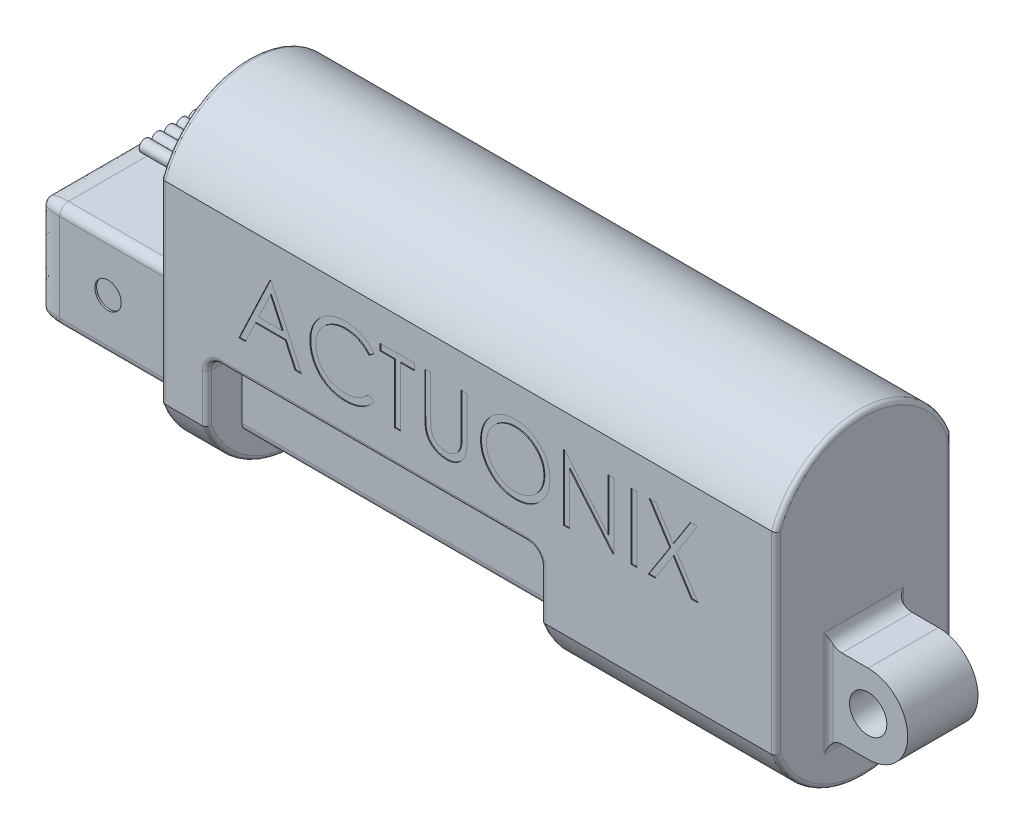
from build123d import *

# Parameters (mm, degrees)
SKETCH1_R               = 2.125
BOSS_EXTRUDE1_DEPTH     = 10
SKETCH2_W               = 9
SKETCH2_H               = 6
CUT_EXTRUDE1_DEPTH      = 58.723478759
SKETCH3_W               = 38
SKETCH3_H               = 4.5
CUT_EXTRUDE2_DEPTH      = 52.575187833
SKETCH4_W               = 38
SKETCH4_H               = 4
CUT_EXTRUDE3_DEPTH      = 9.5
CUT_EXTRUDE4_DEPTH      = 73.965745388
CUT_EXTRUDE4_DEPTH_BACK = 73.965745388
CUT_EXTRUDE5_DEPTH      = 73.965745388
BOSS_EXTRUDE2_DEPTH     = 4.31
SKETCH8_R               = 0.675
BOSS_EXTRUDE3_DEPTH     = 7.5
BOSS_EXTRUDE3_2_DEPTH   = 7.5
BOSS_EXTRUDE3_3_DEPTH   = 7.5
BOSS_EXTRUDE3_4_DEPTH   = 7.5
BOSS_EXTRUDE3_5_DEPTH   = 7.5
BOSS_EXTRUDE4_DEPTH     = 17.5
SKETCH10_R              = 4.5
CUT_EXTRUDE6_DEPTH      = 50
SKETCH12_W              = 0.673076923
SKETCH12_H              = 7.5
CUT_EXTRUDE7_DEPTH      = 0.1
SKETCH13_W              = 0.673076923
SKETCH13_H              = 7.5
CUT_EXTRUDE8_DEPTH      = 0.1
FILLET1_SIZE            = 2
FILLET1_SIZE_2          = 0.5
SKETCH14_R              = 1.5
CUT_EXTRUDE9_DEPTH      = 0.2
SKETCH15_R              = 1.5
CUT_EXTRUDE10_DEPTH     = 0.2
FILLET2_R               = 1.5
FILLET3_R               = 1.5
FILLET4_R               = 0.5
FILLET5_R               = 1
FILLET6_R               = 0.5


with BuildPart() as part:
    # Sketch1 → Boss-Extrude1 (new, symmetric)
    with BuildSketch(Plane.XY):
        with BuildLine():
            Line((39.5, -12), (35, -12))
            Line((35, -12), (35, -18))
            Line((35, -18), (-35, -18))
            Line((-35, -18), (-35, 18))
            Line((-35, 18), (35, 18))
            Line((35, 18), (35, -3))
            Line((35, -3), (39.5, -3))
            ThreePointArc((39.5, -3), (44, -7.5), (39.5, -12))
        make_face()
        with Locations((39.5, -7.5)):
            Circle(SKETCH1_R, mode=Mode.SUBTRACT)
    extrude(amount=BOSS_EXTRUDE1_DEPTH, both=True)

    # Sketch2 → Cut-Extrude1 (cut, through all)
    with BuildSketch(Plane(origin=(0, 18, 0), x_dir=(1, 0, 0), z_dir=(0, 1, 0))):
        with Locations((39.5, -7)):
            Rectangle(SKETCH2_W, SKETCH2_H)
        with Locations((39.5, 7)):
            Rectangle(SKETCH2_W, SKETCH2_H)
    extrude(amount=-CUT_EXTRUDE1_DEPTH, mode=Mode.SUBTRACT)

    # Sketch3 → Cut-Extrude2 (cut, through all)
    with BuildSketch(Plane.XY.offset(10)):
        with Locations((-10.75, -15.75)):
            Rectangle(SKETCH3_W, SKETCH3_H)
    extrude(amount=-CUT_EXTRUDE2_DEPTH, mode=Mode.SUBTRACT)

    # Sketch4 → Cut-Extrude3 (cut)
    with BuildSketch(Plane.XZ.offset(13.5)):
        with Locations((-10.75, -8)):
            Rectangle(SKETCH4_W, SKETCH4_H)
        with Locations((-10.75, 8)):
            Rectangle(SKETCH4_W, SKETCH4_H)
    extrude(amount=-CUT_EXTRUDE3_DEPTH, mode=Mode.SUBTRACT)

    # Sketch6 → Cut-Extrude4 (cut, two sides: drawn at the far end of the back side and taken through both)
    with BuildSketch(Plane(origin=(35, 0, 0), x_dir=(0, 0, -1), z_dir=(1, 0, 0)).offset(-CUT_EXTRUDE4_DEPTH_BACK)):
        with BuildLine():
            Line((-10, 18), (-10, 11))
            ThreePointArc((-10, 11), (-6.103277819, 16.076111146), (-2.8e-08, 18))
            Line((-2.8e-08, 18), (-10, 18))
        make_face()
        with BuildLine():
            Line((10, 18), (-2.8e-08, 18))
            ThreePointArc((-2.8e-08, 18), (6.103277797, 16.076111162), (10, 11))
            Line((10, 11), (10, 18))
        make_face()
    extrude(amount=CUT_EXTRUDE4_DEPTH + CUT_EXTRUDE4_DEPTH_BACK, mode=Mode.SUBTRACT)

    # Sketch7 → Cut-Extrude5 (cut, through all)
    with BuildSketch(Plane(origin=(35, 0, 0), x_dir=(0, 0, -1), z_dir=(1, 0, 0))):
        with BuildLine():
            ThreePointArc((-4.6e-08, -18), (-6.103277827, -16.076111141), (-10, -11))
            Line((-10, -11), (-10, -18))
            Line((-10, -18), (-4.6e-08, -18))
        make_face()
        with BuildLine():
            ThreePointArc((10, -11), (6.103277789, -16.076111167), (-4.6e-08, -18))
            Line((-4.6e-08, -18), (10, -18))
            Line((10, -18), (10, -11))
        make_face()
    extrude(amount=-CUT_EXTRUDE5_DEPTH, mode=Mode.SUBTRACT)


with BuildPart() as body_2:
    # Sketch5 → Boss-Extrude2 (new body)
    with BuildSketch(Plane.ZY.offset(35)):
        with BuildLine():
            Line((-5.625, 5.25), (1.125, 5.25))
            ThreePointArc((1.125, 5.25), (3, 3.375), (1.125, 1.5))
            Line((1.125, 1.5), (-5.625, 1.5))
            ThreePointArc((-5.625, 1.5), (-7.5, 3.375), (-5.625, 5.25))
        make_face()
    extrude(amount=BOSS_EXTRUDE2_DEPTH)


with BuildPart() as body_3:
    # Sketch8 → Boss-Extrude3 (new body)
    with BuildSketch(Plane.ZY.offset(39.31)):
        with Locations((-5.625, 3.375)):
            Circle(SKETCH8_R)
    extrude(amount=BOSS_EXTRUDE3_DEPTH)


with BuildPart() as body_4:
    # Sketch8 → Boss-Extrude3 2 (new body)
    with BuildSketch(Plane.ZY.offset(39.31)):
        with Locations((-4.225, 3.375)):
            Circle(SKETCH8_R)
    extrude(amount=BOSS_EXTRUDE3_2_DEPTH)


with BuildPart() as body_5:
    # Sketch8 → Boss-Extrude3 3 (new body)
    with BuildSketch(Plane.ZY.offset(39.31)):
        with Locations((-2.825, 3.375)):
            Circle(SKETCH8_R)
    extrude(amount=BOSS_EXTRUDE3_3_DEPTH)


with BuildPart() as body_6:
    # Sketch8 → Boss-Extrude3 4 (new body)
    with BuildSketch(Plane.ZY.offset(39.31)):
        with Locations((-1.425, 3.375)):
            Circle(SKETCH8_R)
    extrude(amount=BOSS_EXTRUDE3_4_DEPTH)


with BuildPart() as body_7:
    # Sketch8 → Boss-Extrude3 5 (new body)
    with BuildSketch(Plane.ZY.offset(39.31)):
        with Locations((-0.025, 3.375)):
            Circle(SKETCH8_R)
    extrude(amount=BOSS_EXTRUDE3_5_DEPTH)


with BuildPart() as body_8:
    # Sketch9 → Boss-Extrude4 (new body)
    with BuildSketch(Plane.ZY.offset(35)):
        with BuildLine():
            Line((-6, -4), (-6, -2.5))
            ThreePointArc((-6, -2.5), (-5.707106781, -1.792893219), (-5, -1.5))
            Line((-5, -1.5), (5, -1.5))
            ThreePointArc((5, -1.5), (5.707106781, -1.792893219), (6, -2.5))
            Line((6, -2.5), (6, -4))
            Line((6, -4), (6, -12.5))
            ThreePointArc((6, -12.5), (5.707106781, -13.207106781), (5, -13.5))
            Line((5, -13.5), (-5, -13.5))
            ThreePointArc((-5, -13.5), (-5.707106781, -13.207106781), (-6, -12.5))
            Line((-6, -12.5), (-6, -4))
        make_face()
    extrude(amount=BOSS_EXTRUDE4_DEPTH)


with BuildPart() as cut_extrude6_tool:
    # Sketch10 → Cut-Extrude6 (new body)
    with BuildSketch(Plane.ZY.offset(52.5)):
        with Locations((0, -7.5)):
            Circle(SKETCH10_R)
    extrude(amount=-CUT_EXTRUDE6_DEPTH)


with BuildPart() as part_1:
    add(part.part)

    # Cut-Extrude6: cut by cut_extrude6_tool
    add(cut_extrude6_tool.part, mode=Mode.SUBTRACT)

    # Sketch12 → Cut-Extrude7 (cut)
    # profile 1 of 8: a face of its own
    with BuildSketch(Plane.XY.offset(10)):
        Polygon((-22.451923077, 7.25), (-18.990384615, -0.25), (-19.722055288, -0.25), (-20.830829327, 2.153846154), (-24.230769231, 2.153846154), (-25.37109375, -0.25), (-26.105769231, -0.25), (-22.548076923, 7.25), align=None)
        Polygon((-22.507512019, 5.788161058), (-23.865685096, 2.923076923), (-21.185396635, 2.923076923), align=None, mode=Mode.SUBTRACT)
    # profile 2 of 8: a face of its own
    with BuildSketch(Plane.XY.offset(10)):
        with BuildLine():
            Line((-10.721153846, 5.873798077), (-11.310096154, 5.423076923))
            add(Edge.make_bspline(
                [(-11.310096154, 5.423076923), (-11.352108772, 5.473146858), (-11.435567586, 5.572611678), (-11.569837306, 5.71228213), (-11.709769398, 5.843136262), (-11.855310372, 5.965797433), (-12.009079914, 6.075976216), (-12.167353054, 6.179414294), (-12.332777436, 6.272130875), (-12.561531153, 6.38455156), (-12.860776543, 6.501864749), (-13.237479769, 6.600228816), (-13.630717837, 6.662845621), (-13.898998408, 6.669627424), (-14.035456731, 6.673076923)],
                knots=[0, 0, 0, 0, 0.757959112, 1.505699292, 2.245454638, 2.979532153, 3.711538275, 4.438200793, 5.171680507, 5.909471876, 7.393775596, 8.890124382, 10.418191784, 12, 12, 12, 12], degree=3))
            add(Edge.make_bspline(
                [(-14.035456731, 6.673076923), (-14.110635229, 6.672211289), (-14.260294499, 6.670488055), (-14.482398371, 6.647754215), (-14.700354909, 6.615801622), (-14.914022337, 6.568390216), (-15.123128676, 6.508448889), (-15.329040967, 6.436823002), (-15.528777966, 6.348205488), (-15.725102762, 6.250259217), (-15.913201072, 6.139628978), (-16.091176174, 6.01895751), (-16.258378962, 5.88959516), (-16.414941703, 5.751057075), (-16.561024449, 5.60396716), (-16.695568687, 5.446757856), (-16.818108851, 5.27993177), (-16.931073905, 5.105688754), (-17.032244048, 4.924536343), (-17.116950932, 4.73580405), (-17.191961909, 4.542723829), (-17.251317428, 4.343114198), (-17.298298536, 4.1383797), (-17.330714957, 3.927970869), (-17.353190253, 3.71232727), (-17.354904917, 3.566164457), (-17.355769231, 3.492487981)],
                knots=[0, 0, 0, 0, 1.054917814, 2.100044995, 3.131103042, 4.146048494, 5.169673617, 6.183595914, 7.203665975, 8.234915748, 9.262203917, 10.264457458, 11.251630812, 12.227803204, 13.197192746, 14.159520551, 15.12972552, 16.100847026, 17.073214652, 18.039054194, 19.002613845, 19.979014051, 20.95965708, 21.949030935, 22.966165397, 24, 24, 24, 24], degree=3))
            add(Edge.make_bspline(
                [(-17.355769231, 3.492487981), (-17.353065333, 3.381635152), (-17.347756588, 3.163990328), (-17.300510158, 2.845196162), (-17.228713534, 2.539794718), (-17.121108726, 2.249695056), (-16.988425046, 1.971320003), (-16.820766593, 1.709379603), (-16.626588299, 1.459915536), (-16.403143114, 1.228823505), (-16.157987794, 1.017722666), (-15.894956555, 0.831828562), (-15.61470451, 0.6768681), (-15.320326016, 0.547919643), (-15.009555772, 0.448798084), (-14.682952624, 0.379017819), (-14.34122692, 0.333498861), (-14.107721063, 0.329140958), (-13.988882212, 0.326923077)],
                knots=[0, 0, 0, 0, 1.029171465, 2.020641659, 2.987623507, 3.938342917, 4.889210282, 5.84687017, 6.821220943, 7.821438502, 8.827599549, 9.822697543, 10.807740252, 11.797342354, 12.80366471, 13.83203677, 14.896651826, 16, 16, 16, 16], degree=3))
            add(Edge.make_bspline(
                [(-13.988882212, 0.326923077), (-13.857947878, 0.330541891), (-13.600237787, 0.337664582), (-13.222306302, 0.39800583), (-12.860515376, 0.495844225), (-12.514845548, 0.632768345), (-12.186271306, 0.81076539), (-11.874278462, 1.026546556), (-11.578603668, 1.282164412), (-11.400808064, 1.477342544), (-11.310096154, 1.576923077)],
                knots=[0, 0, 0, 0, 1.028121516, 2.023589091, 2.998037872, 3.967518031, 4.937445131, 5.927275754, 6.942489185, 8, 8, 8, 8], degree=3))
            Line((-11.310096154, 1.576923077), (-10.721153846, 1.130709135))
            add(Edge.make_bspline(
                [(-10.721153846, 1.130709135), (-10.768549796, 1.069555309), (-10.863114671, 0.947540581), (-11.016238994, 0.775529775), (-11.177547488, 0.613735413), (-11.348238295, 0.463461939), (-11.526347849, 0.32170237), (-11.715074232, 0.19248416), (-11.911936445, 0.074003694), (-12.116267471, -0.034482573), (-12.327850213, -0.130733817), (-12.546431145, -0.213134748), (-12.771068092, -0.284116654), (-13.001771324, -0.342513661), (-13.239019375, -0.388094555), (-13.481956105, -0.418565287), (-13.731105838, -0.439440818), (-13.899194597, -0.441343495), (-13.984375, -0.442307692)],
                knots=[0, 0, 0, 0, 0.986787822, 1.968848986, 2.935600012, 3.899624008, 4.868462664, 5.837806735, 6.815139263, 7.798259679, 8.787526145, 9.778297419, 10.776456485, 11.791383307, 12.812564526, 13.85620153, 14.913611965, 16, 16, 16, 16], degree=3))
            add(Edge.make_bspline(
                [(-13.984375, -0.442307692), (-14.065040001, -0.44174628), (-14.224545051, -0.440636156), (-14.460042376, -0.42265294), (-14.689305763, -0.398117789), (-14.911679962, -0.361174651), (-15.12837848, -0.317579637), (-15.337436875, -0.25914123), (-15.540912326, -0.19367873), (-15.737987341, -0.116739473), (-15.928829555, -0.029919082), (-16.112823437, 0.068205687), (-16.289884363, 0.176809683), (-16.461753122, 0.293498991), (-16.625890802, 0.422021781), (-16.783719785, 0.560593141), (-16.936125091, 0.708746021), (-17.030416559, 0.815577849), (-17.077824519, 0.869290865)],
                knots=[0, 0, 0, 0, 1.114604814, 2.203992996, 3.262667896, 4.300477797, 5.318619304, 6.316056647, 7.298880507, 8.271930387, 9.238335007, 10.195173496, 11.151986948, 12.108099108, 13.064862484, 14.031167946, 15.010108607, 16, 16, 16, 16], degree=3))
            add(Edge.make_bspline(
                [(-17.077824519, 0.869290865), (-17.153758041, 0.962593413), (-17.304708349, 1.148072078), (-17.497834813, 1.448684895), (-17.663151003, 1.762545343), (-17.79681369, 2.091302333), (-17.901305261, 2.434218163), (-17.973693537, 2.791465694), (-18.020732689, 3.162711284), (-18.026111879, 3.415218688), (-18.028846154, 3.543569712)],
                knots=[0, 0, 0, 0, 0.994628077, 1.977248131, 2.950237994, 3.925870899, 4.908910175, 5.911660606, 6.938484602, 8, 8, 8, 8], degree=3))
            add(Edge.make_bspline(
                [(-18.028846154, 3.543569712), (-18.025513596, 3.678474255), (-18.018956997, 3.943890522), (-17.963251721, 4.333406136), (-17.873640015, 4.706587705), (-17.746360968, 5.062738586), (-17.584992358, 5.403732044), (-17.385649614, 5.726963197), (-17.150648595, 6.034499196), (-16.881832379, 6.321673663), (-16.587045232, 6.58425799), (-16.271362059, 6.815271284), (-15.935400744, 7.007523104), (-15.58286249, 7.168229167), (-15.211107458, 7.291753016), (-14.82092881, 7.37822413), (-14.413059707, 7.432046522), (-14.134783081, 7.438850539), (-13.993389423, 7.442307692)],
                knots=[0, 0, 0, 0, 1.032925535, 2.032216505, 3.007276963, 3.968222605, 4.92396291, 5.891752235, 6.871517503, 7.883894988, 8.900124299, 9.891468569, 10.874487609, 11.85992873, 12.854644235, 13.869047385, 14.917252991, 16, 16, 16, 16], degree=3))
            add(Edge.make_bspline(
                [(-13.993389423, 7.442307692), (-13.907215555, 7.441274539), (-13.73664306, 7.439229516), (-13.484315948, 7.419287783), (-13.238653819, 7.386044341), (-12.999487429, 7.34079562), (-12.765653251, 7.284637074), (-12.538938449, 7.211479292), (-12.318012692, 7.127829582), (-12.104269317, 7.031490012), (-11.898733853, 6.923346995), (-11.701470313, 6.80459923), (-11.514045616, 6.675393933), (-11.33514094, 6.536829985), (-11.16774906, 6.38597593), (-11.00711732, 6.226981081), (-10.858700724, 6.055265744), (-10.767086735, 5.934398028), (-10.721153846, 5.873798077)],
                knots=[0, 0, 0, 0, 1.096760587, 2.17092713, 3.219439832, 4.250915756, 5.268269357, 6.278326846, 7.281116186, 8.274029601, 9.260640565, 10.235837813, 11.203064059, 12.156899882, 13.114053108, 14.069676657, 15.032185724, 16, 16, 16, 16], degree=3))
        make_face()
    # profile 3 of 8: a face of its own
    with BuildSketch(Plane.XY.offset(10)):
        Polygon((-10.048076923, 6.480769231), (-10.048076923, 7.25), (-6.105769231, 7.25), (-6.105769231, 6.480769231), (-7.740384615, 6.480769231), (-7.740384615, -0.25), (-8.413461538, -0.25), (-8.413461538, 6.480769231), align=None)
    # profile 4 of 8: a face of its own
    with BuildSketch(Plane.XY.offset(10)):
        with BuildLine():
            Line((-4.951923077, 7.25), (-4.278846154, 7.25))
            Line((-4.278846154, 7.25), (-4.278846154, 2.756310096))
            add(Edge.make_bspline(
                [(-4.278846154, 2.756310096), (-4.27894632, 2.69270852), (-4.279136401, 2.572013568), (-4.277866729, 2.400224352), (-4.274310939, 2.247497654), (-4.272069169, 2.113244766), (-4.267082025, 1.998081736), (-4.263014782, 1.901384642), (-4.257785018, 1.823611351), (-4.251499766, 1.778223652), (-4.248798077, 1.758713942)],
                knots=[0, 0, 0, 0, 1.528628734, 2.90083645, 4.128790002, 5.200304208, 6.127813768, 6.898992206, 7.526736466, 8, 8, 8, 8], degree=3))
            add(Edge.make_bspline(
                [(-4.248798077, 1.758713942), (-4.237703522, 1.688328021), (-4.216139552, 1.551522173), (-4.161183028, 1.356718712), (-4.08443124, 1.181151301), (-3.993481863, 1.019341391), (-3.873626267, 0.875792763), (-3.730047263, 0.743553507), (-3.556094902, 0.62789964), (-3.362679318, 0.5221479), (-3.154210952, 0.437151295), (-2.94118681, 0.3728798), (-2.726808997, 0.333710729), (-2.583288644, 0.329175288), (-2.512019231, 0.326923077)],
                knots=[0, 0, 0, 0, 1.035780045, 2.013197591, 2.933192213, 3.817615948, 4.702609284, 5.640816605, 6.646850145, 7.73207398, 8.84249596, 9.914020372, 10.964143139, 12, 12, 12, 12], degree=3))
            add(Edge.make_bspline(
                [(-2.512019231, 0.326923077), (-2.450832644, 0.329224185), (-2.328812869, 0.33381311), (-2.147513374, 0.362230462), (-1.970941713, 0.41344596), (-1.79822597, 0.479531156), (-1.636331004, 0.566847423), (-1.485166485, 0.667713507), (-1.350243769, 0.786022528), (-1.227119488, 0.916951837), (-1.119901768, 1.06467998), (-1.026963608, 1.225990276), (-0.950836615, 1.403310305), (-0.913243348, 1.527926924), (-0.893930288, 1.591947115)],
                knots=[0, 0, 0, 0, 0.994687771, 1.983630487, 2.973142513, 3.978332533, 4.983357753, 5.956394766, 6.925816176, 7.893390482, 8.871859704, 9.88551698, 10.913711441, 12, 12, 12, 12], degree=3))
            add(Edge.make_bspline(
                [(-0.893930288, 1.591947115), (-0.887501449, 1.618408346), (-0.873175402, 1.677374632), (-0.859788877, 1.777063112), (-0.845846323, 1.894683177), (-0.836172244, 2.031079919), (-0.826741058, 2.185796289), (-0.821098759, 2.359638269), (-0.818490831, 2.551974614), (-0.817713659, 2.686197103), (-0.817307692, 2.756310096)],
                knots=[0, 0, 0, 0, 0.558680831, 1.244966039, 2.062412453, 2.990489873, 4.051219941, 5.244515665, 6.560634259, 8, 8, 8, 8], degree=3))
            Line((-0.817307692, 2.756310096), (-0.817307692, 7.25))
            Line((-0.817307692, 7.25), (-0.144230769, 7.25))
            Line((-0.144230769, 7.25), (-0.144230769, 2.720252404))
            add(Edge.make_bspline(
                [(-0.144230769, 2.720252404), (-0.144775313, 2.63861302), (-0.145838023, 2.4792888), (-0.155053544, 2.245821602), (-0.169747115, 2.024350928), (-0.190507304, 1.814847007), (-0.218015168, 1.618059523), (-0.248604926, 1.432263591), (-0.287561068, 1.258792892), (-0.333061214, 1.096294854), (-0.385075959, 0.941611611), (-0.452449849, 0.794807437), (-0.528359491, 0.651419438), (-0.61839089, 0.513616347), (-0.719558139, 0.380788019), (-0.834097455, 0.253740001), (-0.958220657, 0.130442045), (-1.093991142, 0.014056903), (-1.239170839, -0.092675976), (-1.393327891, -0.186528342), (-1.555278112, -0.265864666), (-1.724600525, -0.331170218), (-1.901367388, -0.38027293), (-2.085583159, -0.41686255), (-2.277667145, -0.437653187), (-2.408305694, -0.440743038), (-2.474459135, -0.442307692)],
                knots=[0, 0, 0, 0, 1.316592851, 2.569410997, 3.76748051, 4.895814652, 5.963796859, 6.97159953, 7.931736103, 8.829262218, 9.692595152, 10.560224239, 11.431080259, 12.30701507, 13.211635791, 14.121146779, 15.063487852, 16.031507147, 17.00238618, 17.966455255, 18.938106653, 19.907068911, 20.888905087, 21.893141452, 22.933117798, 24, 24, 24, 24], degree=3))
            add(Edge.make_bspline(
                [(-2.474459135, -0.442307692), (-2.546607212, -0.440626052), (-2.688161481, -0.437326681), (-2.896743053, -0.418420788), (-3.096702045, -0.382809943), (-3.290150353, -0.337467206), (-3.474454276, -0.274930627), (-3.652083085, -0.201863216), (-3.819994545, -0.11212623), (-3.980912677, -0.012283245), (-4.130537155, 0.100055266), (-4.267888733, 0.222498495), (-4.39319417, 0.353085018), (-4.504341376, 0.493228659), (-4.603171843, 0.64183946), (-4.688308015, 0.799337831), (-4.761407824, 0.965662794), (-4.799136182, 1.081276795), (-4.818209135, 1.139723558)],
                knots=[0, 0, 0, 0, 1.13879206, 2.234305948, 3.301075583, 4.341971843, 5.366689343, 6.369221514, 7.369726634, 8.367512178, 9.355451585, 10.318319045, 11.268648973, 12.207971039, 13.137398894, 14.081662264, 15.030215811, 16, 16, 16, 16], degree=3))
            add(Edge.make_bspline(
                [(-4.818209135, 1.139723558), (-4.829303045, 1.179650503), (-4.853365984, 1.266252936), (-4.879134479, 1.409581126), (-4.900796796, 1.574613093), (-4.92116585, 1.761360132), (-4.933185045, 1.969966989), (-4.943722414, 2.200343237), (-4.951997311, 2.452767441), (-4.951948513, 2.628598546), (-4.951923077, 2.720252404)],
                knots=[0, 0, 0, 0, 0.625038921, 1.35572334, 2.194682327, 3.136881307, 4.189498639, 5.346923369, 6.617055217, 8, 8, 8, 8], degree=3))
            Line((-4.951923077, 2.720252404), (-4.951923077, 7.25))
        make_face()
    # profile 5 of 8: a face of its own
    with BuildSketch(Plane.XY.offset(10)):
        with BuildLine():
            add(Edge.make_bspline(
                [(5.288461538, 7.442307692), (5.427336051, 7.438790237), (5.700097052, 7.431881663), (6.100971833, 7.37899787), (6.483675608, 7.287507748), (6.851325906, 7.1656585), (7.199525141, 7.003113389), (7.530894196, 6.806645214), (7.84464464, 6.574195659), (8.136547601, 6.307561602), (8.403669637, 6.0174542), (8.639010822, 5.707858679), (8.836244309, 5.38064696), (8.998213852, 5.036802323), (9.125282302, 4.677102391), (9.212965967, 4.299629528), (9.268976289, 3.906829478), (9.275524383, 3.638914768), (9.278846154, 3.503004808)],
                knots=[0, 0, 0, 0, 1.065120563, 2.091984664, 3.0946048, 4.079830382, 5.057816894, 6.036188127, 7.030412546, 8.04752943, 9.064399622, 10.05169764, 11.02544977, 11.989514704, 12.962713494, 13.945757189, 14.957906945, 16, 16, 16, 16], degree=3))
            add(Edge.make_bspline(
                [(9.278846154, 3.503004808), (9.27552487, 3.368095994), (9.268978234, 3.102175093), (9.212902283, 2.711867713), (9.124957283, 2.336673363), (8.999393855, 1.977218393), (8.838196401, 1.633123613), (8.639649606, 1.305294427), (8.405775583, 0.993623359), (8.139618045, 0.70152479), (7.849472955, 0.433673067), (7.53826524, 0.200275477), (7.21299384, -0.000561933), (6.869473037, -0.160812663), (6.512258673, -0.28889535), (6.138153695, -0.376222414), (5.748911079, -0.432551793), (5.483473214, -0.439020041), (5.348557692, -0.442307692)],
                knots=[0, 0, 0, 0, 1.043624062, 2.057103931, 3.04512605, 4.022047818, 4.998200453, 5.980619268, 6.982898556, 8.009068085, 9.034988726, 10.034168286, 11.015286542, 11.987931943, 12.962482838, 13.94673481, 14.956375938, 16, 16, 16, 16], degree=3))
            add(Edge.make_bspline(
                [(5.348557692, -0.442307692), (5.212648437, -0.438987578), (4.944735117, -0.432442748), (4.55144147, -0.376339737), (4.173703448, -0.288608372), (3.812601267, -0.163231009), (3.46793356, -0.001194086), (3.13902624, 0.196386726), (2.827199496, 0.4308306), (2.535038611, 0.696901832), (2.2677189, 0.986555157), (2.034663095, 1.296914275), (1.837037853, 1.621890254), (1.675544997, 1.962384948), (1.547692584, 2.316752326), (1.460467974, 2.687356206), (1.404033791, 3.072083718), (1.397530549, 3.334032786), (1.394230769, 3.466947115)],
                knots=[0, 0, 0, 0, 1.053102029, 2.075944431, 3.073151272, 4.055350789, 5.033113405, 6.020478099, 7.024410459, 8.052272461, 9.079885166, 10.07527673, 11.055994387, 12.023226415, 12.992069828, 13.970394897, 14.97016774, 16, 16, 16, 16], degree=3))
            add(Edge.make_bspline(
                [(1.394230769, 3.466947115), (1.395376417, 3.556159978), (1.397653259, 3.733460242), (1.425064028, 3.996745814), (1.464839102, 4.255797224), (1.521843201, 4.509877827), (1.596396773, 4.758365651), (1.684365403, 5.002974428), (1.791807929, 5.241225265), (1.91326646, 5.474246819), (2.048827478, 5.698406617), (2.198561226, 5.910291438), (2.357208444, 6.111679288), (2.531130002, 6.297351439), (2.714593813, 6.472709274), (2.910576052, 6.635057954), (3.117880862, 6.78586142), (3.337400247, 6.921762151), (3.563725122, 7.044674582), (3.797032503, 7.150149977), (4.034153727, 7.240677252), (4.276199401, 7.314050449), (4.52252677, 7.37197624), (4.773673451, 7.411420569), (5.029439365, 7.438901251), (5.201749334, 7.441167326), (5.288461538, 7.442307692)],
                knots=[0, 0, 0, 0, 1.037015668, 2.060948919, 3.074880161, 4.083647147, 5.086022904, 6.090072063, 7.104153813, 8.122640571, 9.144368836, 10.147691507, 11.138137339, 12.123020368, 13.103399296, 14.087645067, 15.080126199, 16.082011238, 17.087798457, 18.072939717, 19.057185487, 20.037253025, 21.01195951, 21.997135196, 22.992090687, 24, 24, 24, 24], degree=3))
        make_face()
        with BuildLine():
            add(Edge.make_bspline(
                [(5.321514423, 6.673076923), (5.250340208, 6.672209301), (5.108672209, 6.670482352), (4.898062489, 6.64773439), (4.69022263, 6.615313199), (4.485109712, 6.569067083), (4.283581949, 6.506058399), (4.08376086, 6.433542167), (3.887468602, 6.345211258), (3.695353192, 6.245412606), (3.509106603, 6.134950633), (3.3333651, 6.012868275), (3.16767372, 5.882028516), (3.012438148, 5.742126007), (2.868114208, 5.592448289), (2.731861276, 5.435264498), (2.609140744, 5.266081874), (2.496671651, 5.089488145), (2.396026279, 4.905713328), (2.30652909, 4.716692195), (2.2333205, 4.520882866), (2.173615408, 4.320409671), (2.124115813, 4.115590115), (2.092757404, 3.904870438), (2.069759491, 3.689309484), (2.068131251, 3.543634083), (2.067307692, 3.469951923)],
                knots=[0, 0, 0, 0, 1.008559885, 2.007477868, 2.99961109, 3.989939068, 4.984837346, 5.991145699, 7.001802488, 8.033829008, 9.059044045, 10.069351652, 11.065060232, 12.050310815, 13.029377138, 14.011219647, 14.996725999, 15.989392538, 16.977580475, 17.965360261, 18.951710183, 19.937753436, 20.929683414, 21.935841486, 22.955955122, 24, 24, 24, 24], degree=3))
            add(Edge.make_bspline(
                [(2.067307692, 3.469951923), (2.070039539, 3.361604307), (2.075413928, 3.148451028), (2.122465864, 2.83609072), (2.194941523, 2.535901535), (2.301778737, 2.249526015), (2.435387197, 1.974502551), (2.600444819, 1.713270899), (2.796000002, 1.465760454), (3.018136131, 1.233699163), (3.260970502, 1.021886725), (3.518826352, 0.835965135), (3.788941225, 0.678657457), (4.072019517, 0.550503731), (4.366549957, 0.448954292), (4.674430424, 0.379357226), (4.99360998, 0.333552678), (5.21117567, 0.329153916), (5.321514423, 0.326923077)],
                knots=[0, 0, 0, 0, 1.032063989, 2.030389145, 3.003944642, 3.970395727, 4.937377036, 5.913328081, 6.909231446, 7.93887556, 8.970685674, 9.976071282, 10.964166581, 11.944589148, 12.933237628, 13.927779006, 14.949070134, 16, 16, 16, 16], degree=3))
            add(Edge.make_bspline(
                [(5.321514423, 0.326923077), (5.395677641, 0.327942015), (5.542765576, 0.329962875), (5.761541695, 0.350317182), (5.976376435, 0.382956902), (6.186968463, 0.429951164), (6.393078773, 0.488766607), (6.595567637, 0.55864031), (6.792278259, 0.645814318), (6.985692197, 0.742131357), (7.170827001, 0.851931694), (7.347560284, 0.969870586), (7.511437384, 1.100517631), (7.666556823, 1.238341515), (7.811473299, 1.386121189), (7.945206837, 1.543664521), (8.06730712, 1.71196593), (8.179733506, 1.888291799), (8.280026211, 2.072569483), (8.367409995, 2.262275936), (8.441544529, 2.456944028), (8.501391325, 2.656854538), (8.548288743, 2.861627785), (8.580602857, 3.071537953), (8.603206654, 3.286165115), (8.604910391, 3.431330521), (8.605769231, 3.504507212)],
                knots=[0, 0, 0, 0, 1.047197238, 2.076906641, 3.100256066, 4.114471768, 5.12198147, 6.126382909, 7.136867548, 8.15857795, 9.17633901, 10.174870724, 11.156907918, 12.133735059, 13.104061851, 14.077631395, 15.04955518, 16.038496417, 17.029181396, 18.010275684, 18.986308667, 19.968651475, 20.955262928, 21.950658345, 22.966943676, 24, 24, 24, 24], degree=3))
            add(Edge.make_bspline(
                [(8.605769231, 3.504507212), (8.604909703, 3.577183292), (8.603204671, 3.721349685), (8.580613654, 3.93448001), (8.548254603, 4.142879749), (8.501620229, 4.345730756), (8.441512757, 4.543084738), (8.367397049, 4.73475634), (8.279999978, 4.921459615), (8.17969664, 5.102733109), (8.066948447, 5.276678976), (7.943746497, 5.44296986), (7.807963608, 5.598482877), (7.663479269, 5.747057222), (7.506684515, 5.885524128), (7.338289599, 6.013929529), (7.160338861, 6.13537226), (6.971923357, 6.244927035), (6.777472027, 6.346100391), (6.577942117, 6.432781112), (6.375594047, 6.506435654), (6.170942377, 6.569257722), (5.962264567, 6.615132072), (5.750970648, 6.647763607), (5.537352951, 6.670474434), (5.393688909, 6.672206674), (5.321514423, 6.673076923)],
                knots=[0, 0, 0, 0, 1.02996197, 2.043119294, 3.035359645, 4.018872909, 4.991431989, 5.957985074, 6.929999688, 7.912076566, 8.892894881, 9.867085534, 10.843653904, 11.817741046, 12.803660682, 13.806313499, 14.818574707, 15.856120519, 16.894564902, 17.924820532, 18.937903209, 19.946497019, 20.957711757, 21.963978472, 22.977135795, 24, 24, 24, 24], degree=3))
        make_face(mode=Mode.SUBTRACT)
    # profile 6 of 8: a face of its own
    with BuildSketch(Plane.XY.offset(10)):
        Polygon((10.817307692, -0.25), (10.817307692, 7.25), (10.958533654, 7.25), (15.913461538, 1.347055288), (15.913461538, 7.25), (16.586538462, 7.25), (16.586538462, -0.25), (16.433293269, -0.25), (11.490384615, 5.639423077), (11.490384615, -0.25), align=None)
    # profile 7 of 8: a face of its own
    with BuildSketch(Plane.XY.offset(10)):
        with Locations((18.846153847, 3.5)):
            Rectangle(SKETCH12_W, SKETCH12_H)
    # profile 8 of 8: a face of its own
    with BuildSketch(Plane.XY.offset(10)):
        Polygon((20.576923077, 7.25), (21.353665865, 7.25), (23.317307692, 4.182091346), (25.280949519, 7.25), (26.057692308, 7.25), (23.706430288, 3.575120192), (26.153846154, -0.25), (25.377103365, -0.25), (23.317307692, 2.968149038), (21.257512019, -0.25), (20.480769231, -0.25), (22.9296875, 3.575120192), align=None)
    extrude(amount=-CUT_EXTRUDE7_DEPTH, mode=Mode.SUBTRACT)

    # Sketch13 → Cut-Extrude8 (cut)
    # profile 1 of 8: a face of its own
    with BuildSketch(Plane(origin=(0, 0, -10), x_dir=(-1, 0, 0), z_dir=(0, 0, -1))):
        Polygon((-20.576923077, -0.25), (-21.353665865, -0.25), (-23.317307692, 2.817908654), (-25.280949519, -0.25), (-26.057692308, -0.25), (-23.706430288, 3.424879808), (-26.153846154, 7.25), (-25.377103365, 7.25), (-23.317307692, 4.031850962), (-21.257512019, 7.25), (-20.480769231, 7.25), (-22.9296875, 3.424879808), align=None)
    # profile 2 of 8: a face of its own
    with BuildSketch(Plane(origin=(0, 0, -10), x_dir=(-1, 0, 0), z_dir=(0, 0, -1))):
        with Locations((-19.134615385, 3.5)):
            Rectangle(SKETCH13_W, SKETCH13_H)
    # profile 3 of 8: a face of its own
    with BuildSketch(Plane(origin=(0, 0, -10), x_dir=(-1, 0, 0), z_dir=(0, 0, -1))):
        Polygon((-11.105769231, 7.25), (-11.105769231, -0.25), (-11.246995192, -0.25), (-16.201923077, 5.652944712), (-16.201923077, -0.25), (-16.875, -0.25), (-16.875, 7.25), (-16.721754808, 7.25), (-11.778846154, 1.360576923), (-11.778846154, 7.25), align=None)
    # profile 4 of 8: a face of its own
    with BuildSketch(Plane(origin=(0, 0, -10), x_dir=(-1, 0, 0), z_dir=(0, 0, -1))):
        with BuildLine():
            add(Edge.make_bspline(
                [(-5.576923077, -0.442307692), (-5.715812703, -0.438849419), (-5.988603389, -0.432057085), (-6.389149903, -0.378347285), (-6.772689323, -0.289944149), (-7.139450726, -0.165108517), (-7.488007691, -0.00324434), (-7.819462205, 0.193262403), (-8.132674969, 0.426342987), (-8.42683588, 0.690464481), (-8.694199703, 0.980789188), (-8.926849555, 1.292473212), (-9.124856277, 1.619243228), (-9.286634848, 1.963227274), (-9.413754855, 2.322889568), (-9.501424461, 2.700372694), (-9.557438624, 3.09316994), (-9.56398619, 3.361085036), (-9.567307692, 3.496995192)],
                knots=[0, 0, 0, 0, 1.065027606, 2.091802087, 3.093458616, 4.079833113, 5.057734272, 6.036020118, 7.030157768, 8.047461502, 9.064242947, 10.052216774, 11.02588392, 11.989864716, 12.962978571, 13.945936472, 14.957997893, 16, 16, 16, 16], degree=3))
            add(Edge.make_bspline(
                [(-9.567307692, 3.496995192), (-9.563985077, 3.631903423), (-9.557435818, 3.897823175), (-9.501378948, 4.288138913), (-9.413363892, 4.663302576), (-9.28820744, 5.022441582), (-9.126309704, 5.365732267), (-8.927991417, 5.692730912), (-8.695864259, 6.005323772), (-8.429596638, 6.297061759), (-8.13883022, 6.564450245), (-7.829071863, 6.800825686), (-7.50069535, 6.997739983), (-7.158825835, 7.161937002), (-6.800060957, 7.286294311), (-6.426930993, 7.376915737), (-6.037320266, 7.432365389), (-5.77191711, 7.438957225), (-5.637019231, 7.442307692)],
                knots=[0, 0, 0, 0, 1.043683505, 2.0572211, 3.045299494, 4.022276905, 4.994977706, 5.977452478, 6.97747046, 8.003698437, 9.029677512, 10.031249186, 11.013723958, 11.988083691, 12.9614021, 13.946617861, 14.956316495, 16, 16, 16, 16], degree=3))
            add(Edge.make_bspline(
                [(-5.637019231, 7.442307692), (-5.50110971, 7.438988023), (-5.233195866, 7.432444072), (-4.83990603, 7.376334672), (-4.462154033, 7.288626736), (-4.101102971, 7.163163667), (-3.756634359, 7.001627803), (-3.428781514, 6.803124215), (-3.117150469, 6.569214999), (-2.824912431, 6.303156479), (-2.55784637, 6.012947623), (-2.322946347, 5.703595984), (-2.125587174, 5.378043673), (-1.963983118, 5.037632678), (-1.836160463, 4.683242902), (-1.748927775, 4.312645102), (-1.692495783, 3.92791594), (-1.68599224, 3.665967099), (-1.682692308, 3.533052885)],
                knots=[0, 0, 0, 0, 1.053167129, 2.076072758, 3.073341244, 4.055601477, 5.033424535, 6.017524495, 7.021518915, 8.049444456, 9.077120685, 10.074910483, 11.055688766, 12.022980584, 12.991883888, 13.970269434, 14.970104079, 16, 16, 16, 16], degree=3))
            add(Edge.make_bspline(
                [(-1.682692308, 3.533052885), (-1.683836905, 3.443839614), (-1.686111659, 3.266538539), (-1.713537885, 3.003258967), (-1.753255029, 2.744185073), (-1.810473665, 2.490187739), (-1.884280852, 2.241225487), (-1.975235688, 1.997807459), (-2.079469966, 1.757928606), (-2.203575272, 1.526154248), (-2.338977875, 1.302120598), (-2.486620809, 1.088629011), (-2.647533509, 0.889493024), (-2.819417376, 0.70151284), (-3.004651667, 0.527896853), (-3.200448612, 0.364859835), (-3.407832709, 0.214089485), (-3.627131941, 0.078752396), (-3.852755192, -0.045556364), (-4.086339369, -0.149343949), (-4.322956081, -0.241078256), (-4.56468954, -0.313979827), (-4.810980577, -0.371995332), (-5.062137083, -0.411415401), (-5.31790037, -0.438902568), (-5.490210694, -0.441167767), (-5.576923077, -0.442307692)],
                knots=[0, 0, 0, 0, 1.037115869, 2.061148057, 3.07517727, 4.084041727, 5.086514338, 6.092668487, 7.104487461, 8.125783165, 9.147610153, 10.147694368, 11.141876323, 12.122903372, 13.107606018, 14.091946891, 15.084523921, 16.086505767, 17.087268121, 18.077809654, 19.05670789, 20.036870126, 21.011670792, 21.99694167, 22.991993299, 24, 24, 24, 24], degree=3))
        make_face()
        with BuildLine():
            add(Edge.make_bspline(
                [(-5.609975962, 0.326923077), (-5.538800673, 0.327787258), (-5.397130538, 0.329507357), (-5.186536687, 0.3523062), (-4.978637074, 0.38453581), (-4.77388845, 0.431464315), (-4.57210771, 0.491594565), (-4.373070881, 0.565846817), (-4.176600224, 0.652531291), (-3.984492361, 0.753152485), (-3.799815331, 0.865938397), (-3.621459481, 0.984852196), (-3.456236437, 1.116633755), (-3.300954862, 1.256396136), (-3.155991486, 1.406063673), (-3.021326945, 1.564533826), (-2.89709391, 1.732524029), (-2.784781508, 1.909334344), (-2.684832549, 2.093979907), (-2.595343972, 2.282930469), (-2.521161378, 2.47840676), (-2.462397705, 2.679188904), (-2.412520812, 2.884392112), (-2.381234334, 3.0951344), (-2.358217054, 3.310689266), (-2.356591454, 3.456365498), (-2.355769231, 3.530048077)],
                knots=[0, 0, 0, 0, 1.008431664, 2.007222653, 2.999229743, 3.989431819, 4.982149843, 5.98167215, 6.998687425, 8.024288174, 9.053028776, 10.065052016, 11.06063401, 12.045759335, 13.024701188, 14.011819507, 14.991481775, 15.984022113, 16.97831254, 17.965966747, 18.945551853, 19.938269878, 20.93007375, 21.936103907, 22.956087853, 24, 24, 24, 24], degree=3))
            add(Edge.make_bspline(
                [(-2.355769231, 3.530048077), (-2.358507328, 3.63839323), (-2.363894013, 3.851541663), (-2.410856771, 4.163937117), (-2.483771092, 4.464454669), (-2.589483085, 4.751303118), (-2.724339592, 5.025761597), (-2.888837151, 5.286762015), (-3.084482216, 5.534227379), (-3.306587115, 5.766315557), (-3.549452968, 5.978067299), (-3.807217156, 6.164198193), (-4.077840344, 6.320851145), (-4.359762732, 6.451809492), (-4.655391322, 6.550468063), (-4.962830659, 6.620811577), (-5.282087539, 6.666403209), (-5.499642599, 6.670831241), (-5.609975962, 6.673076923)],
                knots=[0, 0, 0, 0, 1.032022337, 2.030307203, 3.003823408, 3.974715386, 4.937372378, 5.913284036, 6.909147208, 7.938749767, 8.970518239, 9.975863271, 10.963918693, 11.946286286, 12.933361397, 13.927862637, 14.949112547, 16, 16, 16, 16], degree=3))
            add(Edge.make_bspline(
                [(-5.609975962, 6.673076923), (-5.684139473, 6.67205881), (-5.831227991, 6.670039587), (-6.049999803, 6.649673188), (-6.264850709, 6.617078844), (-6.475383046, 6.569917044), (-6.68187522, 6.511675708), (-6.883694652, 6.439422098), (-7.080809984, 6.352849135), (-7.274056056, 6.256211628), (-7.45924717, 6.147222643), (-7.634280274, 6.027470463), (-7.800306417, 5.90016154), (-7.955304563, 5.76141131), (-8.099662743, 5.613006292), (-8.231920523, 5.453865674), (-8.356095634, 5.287133926), (-8.467620294, 5.110368553), (-8.568940358, 4.927184028), (-8.655800082, 4.737683407), (-8.730025305, 4.543066919), (-8.789847672, 4.343142508), (-8.836751687, 4.138373015), (-8.869064011, 3.928461828), (-8.891668292, 3.713834941), (-8.893371963, 3.568669498), (-8.894230769, 3.495492788)],
                knots=[0, 0, 0, 0, 1.047362266, 2.077233941, 3.100744636, 4.115120168, 5.122788643, 6.129711893, 7.140355774, 8.162227187, 9.180148637, 10.17298275, 11.156396779, 12.133377858, 13.108923632, 14.078087502, 15.054351192, 16.043448276, 17.028082865, 18.009331763, 18.985518559, 19.968016174, 20.954783108, 21.950335389, 22.966780876, 24, 24, 24, 24], degree=3))
            add(Edge.make_bspline(
                [(-8.894230769, 3.495492788), (-8.893371241, 3.422816708), (-8.89166621, 3.278650315), (-8.869075193, 3.06551999), (-8.836716142, 2.857120251), (-8.790081767, 2.654269245), (-8.729974297, 2.456915259), (-8.655858581, 2.265243669), (-8.568461541, 2.078540349), (-8.468158088, 1.897267025), (-8.355410324, 1.723320528), (-8.232206782, 1.55703198), (-8.096429836, 1.401510242), (-7.951923271, 1.252968514), (-7.79521287, 1.114377818), (-7.626271155, 0.986274106), (-7.449305046, 0.862883672), (-7.260310691, 0.753686994), (-7.065967049, 0.652319354), (-6.866344348, 0.56590916), (-6.663938863, 0.491264746), (-6.458480251, 0.431723283), (-6.250323433, 0.384490222), (-6.039410567, 0.35231788), (-5.82581997, 0.329504908), (-5.68215228, 0.327786418), (-5.609975962, 0.326923077)],
                knots=[0, 0, 0, 0, 1.02988216, 2.042960975, 3.035124439, 4.018561492, 4.99104521, 5.957523397, 6.929462691, 7.91146347, 8.892205782, 9.866320947, 10.842813644, 11.816825305, 12.802668543, 13.805243666, 14.821427616, 15.858893029, 16.897256944, 17.927432741, 18.940436917, 19.95373962, 20.957947499, 21.96413624, 22.977215056, 24, 24, 24, 24], degree=3))
        make_face(mode=Mode.SUBTRACT)
    # profile 5 of 8: a face of its own
    with BuildSketch(Plane(origin=(0, 0, -10), x_dir=(-1, 0, 0), z_dir=(0, 0, -1))):
        with BuildLine():
            Line((4.759615385, -0.25), (4.086538462, -0.25))
            Line((4.086538462, -0.25), (4.086538462, 4.243689904))
            add(Edge.make_bspline(
                [(4.086538462, 4.243689904), (4.086638627, 4.30729148), (4.086828709, 4.427986432), (4.085559036, 4.599775648), (4.082003247, 4.752502346), (4.079761476, 4.886755234), (4.074774333, 5.001918264), (4.07070709, 5.098615358), (4.065477325, 5.176388649), (4.059192073, 5.221776348), (4.056490385, 5.241286058)],
                knots=[0, 0, 0, 0, 1.528628734, 2.90083645, 4.128790002, 5.200304208, 6.127813768, 6.898992206, 7.526736466, 8, 8, 8, 8], degree=3))
            add(Edge.make_bspline(
                [(4.056490385, 5.241286058), (4.045533108, 5.312217878), (4.024380577, 5.44914857), (3.967979099, 5.643898642), (3.893401502, 5.820347915), (3.798358873, 5.98046785), (3.681136007, 6.125384265), (3.536506257, 6.25649043), (3.364768133, 6.37416405), (3.169826638, 6.477384729), (2.961987848, 6.562993827), (2.748857387, 6.627082918), (2.534506607, 6.666298366), (2.39098271, 6.67082773), (2.319711538, 6.673076923)],
                knots=[0, 0, 0, 0, 1.042923073, 2.013316119, 2.939979093, 3.821796737, 4.712412725, 5.640305549, 6.650442997, 7.732186751, 8.842579391, 9.91407549, 10.964170509, 12, 12, 12, 12], degree=3))
            add(Edge.make_bspline(
                [(2.319711538, 6.673076923), (2.258519462, 6.670788698), (2.136488737, 6.666225464), (1.955271011, 6.637616245), (1.778209656, 6.587082552), (1.606733838, 6.518209142), (1.443488099, 6.433648271), (1.292861401, 6.331644875), (1.156439991, 6.214560436), (1.03341342, 6.082943474), (0.926330056, 5.935987445), (0.834147504, 5.774458001), (0.758829479, 5.597066797), (0.720992393, 5.472051498), (0.701622596, 5.408052885)],
                knots=[0, 0, 0, 0, 0.994543961, 1.983343699, 2.972712664, 3.980751554, 4.981834161, 5.954730495, 6.930176574, 7.89761099, 8.875938748, 9.87834379, 10.913868493, 12, 12, 12, 12], degree=3))
            add(Edge.make_bspline(
                [(0.701622596, 5.408052885), (0.695193756, 5.381591654), (0.68086771, 5.322625368), (0.667481185, 5.222936888), (0.653538631, 5.105316823), (0.643864552, 4.968920081), (0.634433365, 4.814203711), (0.628791067, 4.640361731), (0.626183139, 4.448025386), (0.625405967, 4.313802897), (0.625, 4.243689904)],
                knots=[0, 0, 0, 0, 0.558680831, 1.244966039, 2.062412453, 2.990489873, 4.051219941, 5.244515665, 6.560634259, 8, 8, 8, 8], degree=3))
            Line((0.625, 4.243689904), (0.625, -0.25))
            Line((0.625, -0.25), (-0.048076923, -0.25))
            Line((-0.048076923, -0.25), (-0.048076923, 4.279747596))
            add(Edge.make_bspline(
                [(-0.048076923, 4.279747596), (-0.047538323, 4.361387844), (-0.046487213, 4.520713751), (-0.03718912, 4.754168944), (-0.022787255, 4.975682029), (-0.001032227, 5.184974354), (0.023039528, 5.382281456), (0.057189689, 5.566880653), (0.093507433, 5.740337996), (0.139085701, 5.902973427), (0.193303596, 6.057240902), (0.257869334, 6.206054225), (0.336506731, 6.348074492), (0.425519223, 6.485905194), (0.526729265, 6.618276121), (0.63927386, 6.746214452), (0.764954335, 6.868038262), (0.900603172, 6.984329969), (1.045119047, 7.093246643), (1.200123295, 7.185980258), (1.362841304, 7.264462123), (1.531547352, 7.33130712), (1.709092821, 7.380187665), (1.893266202, 7.416886397), (2.085361873, 7.437646957), (2.215998815, 7.440740943), (2.282151442, 7.442307692)],
                knots=[0, 0, 0, 0, 1.316485072, 2.56920066, 3.767172097, 4.895413872, 5.962239305, 6.971350037, 7.921780903, 8.819233545, 9.69278517, 10.557066787, 11.431700348, 12.307563454, 13.200791052, 14.11626757, 15.05287325, 16.020813301, 16.99640464, 17.967304965, 18.928075993, 19.907403966, 20.889159767, 21.893313923, 22.933205135, 24, 24, 24, 24], degree=3))
            add(Edge.make_bspline(
                [(2.282151442, 7.442307692), (2.354300046, 7.440627218), (2.495855349, 7.437330133), (2.704429458, 7.418407734), (2.904415649, 7.382857038), (3.097765734, 7.337297085), (3.282611736, 7.275487435), (3.458899182, 7.19953986), (3.62865222, 7.112834164), (3.788046354, 7.010377713), (3.938389145, 6.898655851), (4.075016367, 6.775941635), (4.201396313, 6.646908652), (4.311958438, 6.50669816), (4.410884569, 6.358180397), (4.495994818, 6.200656815), (4.569101546, 6.034338582), (4.606828965, 5.918723667), (4.625901442, 5.860276442)],
                knots=[0, 0, 0, 0, 1.138939089, 2.234594419, 3.301501784, 4.342532435, 5.367382236, 6.373123747, 7.370098489, 8.372230273, 9.360297234, 10.323289009, 11.268038109, 12.20748145, 13.137029304, 14.081414587, 15.030090602, 16, 16, 16, 16], degree=3))
            add(Edge.make_bspline(
                [(4.625901442, 5.860276442), (4.636995353, 5.820349497), (4.661058291, 5.733747064), (4.686826786, 5.590418874), (4.708489104, 5.425386907), (4.728858157, 5.238639868), (4.740877353, 5.030033011), (4.751414722, 4.799656763), (4.759689619, 4.547232559), (4.759640821, 4.371401454), (4.759615385, 4.279747596)],
                knots=[0, 0, 0, 0, 0.625038921, 1.35572334, 2.194682327, 3.136881307, 4.189498639, 5.346923369, 6.617055217, 8, 8, 8, 8], degree=3))
            Line((4.759615385, 4.279747596), (4.759615385, -0.25))
        make_face()
    # profile 6 of 8: a face of its own
    with BuildSketch(Plane(origin=(0, 0, -10), x_dir=(-1, 0, 0), z_dir=(0, 0, -1))):
        Polygon((10.048076923, 0.519230769), (10.048076923, -0.25), (6.105769231, -0.25), (6.105769231, 0.519230769), (7.740384615, 0.519230769), (7.740384615, 7.25), (8.413461538, 7.25), (8.413461538, 0.519230769), align=None)
    # profile 7 of 8: a face of its own
    with BuildSketch(Plane(origin=(0, 0, -10), x_dir=(-1, 0, 0), z_dir=(0, 0, -1))):
        with BuildLine():
            Line((10.721153846, 1.126201923), (11.310096154, 1.576923077))
            add(Edge.make_bspline(
                [(11.310096154, 1.576923077), (11.352109203, 1.526853804), (11.435568873, 1.4273903), (11.569832263, 1.287710116), (11.709788033, 1.15689239), (11.855241452, 1.034096601), (12.009558649, 0.924258166), (12.166859705, 0.818822776), (12.332860063, 0.726510464), (12.561241198, 0.613739427), (12.861167608, 0.498628694), (13.23742084, 0.399623527), (13.630733309, 0.337193145), (13.899003624, 0.330385646), (14.035456731, 0.326923077)],
                knots=[0, 0, 0, 0, 0.75789156, 1.505565099, 2.245254514, 2.979266606, 3.711207489, 4.440978832, 5.174393176, 5.91211879, 7.394186119, 8.890401545, 10.418332761, 12, 12, 12, 12], degree=3))
            add(Edge.make_bspline(
                [(14.035456731, 0.326923077), (14.110634316, 0.327792617), (14.260291766, 0.329523626), (14.482409124, 0.352199823), (14.700799552, 0.384438543), (14.914650932, 0.431110786), (15.123538657, 0.491873808), (15.329053219, 0.563132624), (15.528774261, 0.651806953), (15.725105163, 0.749736038), (15.913195273, 0.860377436), (16.091196324, 0.981022164), (16.258305512, 1.110478397), (16.414947824, 1.248440215), (16.559544849, 1.396518223), (16.693632705, 1.553048678), (16.817040245, 1.718738481), (16.92964014, 1.892795958), (17.030353645, 2.074361318), (17.117688616, 2.262654658), (17.191512303, 2.456956647), (17.251402737, 2.656850872), (17.298275439, 2.861629757), (17.33072133, 3.072026522), (17.35318861, 3.287673403), (17.354904367, 3.433835768), (17.355769231, 3.507512019)],
                knots=[0, 0, 0, 0, 1.054960097, 2.100129169, 3.131228542, 4.15308236, 5.169990287, 6.183953224, 7.204064171, 8.235355279, 9.262684623, 10.264978336, 11.252191258, 12.228402777, 13.192898315, 14.155264692, 15.119862721, 16.091023151, 17.063429752, 18.032246104, 19.00241354, 19.978852882, 20.959535218, 21.948948728, 22.966123959, 24, 24, 24, 24], degree=3))
            add(Edge.make_bspline(
                [(17.355769231, 3.507512019), (17.353058993, 3.618362377), (17.3477378, 3.836002349), (17.300581372, 4.154831594), (17.228346964, 4.460563433), (17.121859733, 4.751127784), (16.987935144, 5.028946853), (16.820834185, 5.290651514), (16.626569519, 5.540075818), (16.403148237, 5.771178853), (16.157986434, 5.982276708), (15.894956913, 6.168171603), (15.614704414, 6.323131856), (15.320326043, 6.452080369), (15.009555765, 6.551201913), (14.682952626, 6.620982182), (14.34122692, 6.666501139), (14.107721063, 6.670859042), (13.988882212, 6.673076923)],
                knots=[0, 0, 0, 0, 1.029159485, 2.020618137, 2.987588728, 3.942669054, 4.889339625, 5.846988364, 6.821327795, 7.821533711, 8.827683044, 9.822769455, 10.807800696, 11.797391277, 12.803701919, 13.832062008, 14.896664671, 16, 16, 16, 16], degree=3))
            add(Edge.make_bspline(
                [(13.988882212, 6.673076923), (13.857947878, 6.669458109), (13.600237787, 6.662335418), (13.222306302, 6.60199417), (12.860515376, 6.504155775), (12.514845548, 6.367231655), (12.186271306, 6.18923461), (11.874278462, 5.973453444), (11.578603668, 5.717835588), (11.400808064, 5.522657456), (11.310096154, 5.423076923)],
                knots=[0, 0, 0, 0, 1.028121516, 2.023589091, 2.998037872, 3.967518031, 4.937445131, 5.927275754, 6.942489185, 8, 8, 8, 8], degree=3))
            Line((11.310096154, 5.423076923), (10.721153846, 5.869290865))
            add(Edge.make_bspline(
                [(10.721153846, 5.869290865), (10.768551395, 5.930442679), (10.863119461, 6.052453393), (11.016220067, 6.224494039), (11.177617156, 6.386176929), (11.347746429, 6.536660028), (11.526829977, 6.676695504), (11.714789529, 6.805632219), (11.91068761, 6.924900468), (12.114769513, 7.033003125), (12.327046409, 7.129196431), (12.545699133, 7.213269162), (12.771128215, 7.283864431), (13.001555963, 7.343179072), (13.239350018, 7.385541056), (13.481789602, 7.419254712), (13.731131979, 7.439260604), (13.899203389, 7.441282885), (13.984375, 7.442307692)],
                knots=[0, 0, 0, 0, 0.986880684, 1.969034265, 2.935876267, 3.899990983, 4.864973347, 5.834408638, 6.8063673, 7.789580233, 8.778939794, 9.778051223, 10.776304221, 11.791326552, 12.811423977, 13.855999788, 14.91350973, 16, 16, 16, 16], degree=3))
            add(Edge.make_bspline(
                [(13.984375, 7.442307692), (14.065040001, 7.44174628), (14.224545051, 7.440636156), (14.460042376, 7.42265294), (14.689305763, 7.398117789), (14.911679962, 7.361174651), (15.12837848, 7.317579637), (15.337436875, 7.25914123), (15.540912326, 7.19367873), (15.737987341, 7.116739473), (15.928829555, 7.029919082), (16.112823437, 6.931794313), (16.289884363, 6.823190317), (16.461753122, 6.706501009), (16.625890802, 6.577978219), (16.783719785, 6.439406859), (16.936125091, 6.291253979), (17.030416559, 6.184422151), (17.077824519, 6.130709135)],
                knots=[0, 0, 0, 0, 1.114604814, 2.203992996, 3.262667896, 4.300477797, 5.318619304, 6.316056647, 7.298880507, 8.271930387, 9.238335007, 10.195173496, 11.151986948, 12.108099108, 13.064862484, 14.031167946, 15.010108607, 16, 16, 16, 16], degree=3))
            add(Edge.make_bspline(
                [(17.077824519, 6.130709135), (17.153753088, 6.037404662), (17.30469355, 5.851922171), (17.497892936, 5.551337693), (17.662719179, 5.237781489), (17.79747493, 4.909437387), (17.900983069, 4.566177742), (17.973756018, 4.20855476), (18.020716292, 3.837283348), (18.026106353, 3.584779503), (18.028846154, 3.456430288)],
                knots=[0, 0, 0, 0, 0.994611881, 1.977215934, 2.950189954, 3.921972279, 4.908960509, 5.911694611, 6.938501887, 8, 8, 8, 8], degree=3))
            add(Edge.make_bspline(
                [(18.028846154, 3.456430288), (18.025498691, 3.321531389), (18.018912766, 3.056126227), (17.963420233, 2.666530056), (17.873067669, 2.293806483), (17.748651587, 1.936521356), (17.584513509, 1.596718926), (17.385811091, 1.272964062), (17.150603492, 0.965521121), (16.881844693, 0.678320789), (16.587042016, 0.415743458), (16.271362904, 0.184728335), (15.935400518, -0.007523002), (15.582862552, -0.168229194), (15.211107442, -0.291753009), (14.820928815, -0.378224133), (14.413059706, -0.432046522), (14.13478308, -0.438850539), (13.993389423, -0.442307692)],
                knots=[0, 0, 0, 0, 1.032901378, 2.032168977, 3.007206631, 3.966850309, 4.924221947, 5.891988639, 6.871730993, 7.884084801, 8.900290346, 9.89161143, 10.874607481, 11.860025555, 12.854717796, 13.869097222, 14.917278314, 16, 16, 16, 16], degree=3))
            add(Edge.make_bspline(
                [(13.993389423, -0.442307692), (13.907215669, -0.441274412), (13.7366434, -0.439229138), (13.484314636, -0.419289244), (13.23865858, -0.386039041), (12.998991849, -0.340724537), (12.764919129, -0.284362004), (12.53749236, -0.213788668), (12.317363183, -0.128460839), (12.103047263, -0.033493079), (11.897292488, 0.075270647), (11.700201208, 0.193491924), (11.513373764, 0.323447298), (11.335595689, 0.463241411), (11.167688905, 0.613949681), (11.007133476, 0.773038898), (10.858696647, 0.944729214), (10.767085373, 1.065600288), (10.721153846, 1.126201923)],
                knots=[0, 0, 0, 0, 1.096566765, 2.170543479, 3.218870886, 4.250164525, 5.273529809, 6.281496242, 7.278154839, 8.276706968, 9.263143576, 10.238168486, 11.199979644, 12.157579042, 13.114563119, 14.070017788, 15.032356758, 16, 16, 16, 16], degree=3))
        make_face()
    # profile 8 of 8: a face of its own
    with BuildSketch(Plane(origin=(0, 0, -10), x_dir=(-1, 0, 0), z_dir=(0, 0, -1))):
        Polygon((22.259615385, -0.25), (18.798076923, 7.25), (19.529747596, 7.25), (20.638521635, 4.846153846), (24.038461538, 4.846153846), (25.178786058, 7.25), (25.913461538, 7.25), (22.355769231, -0.25), align=None)
        Polygon((22.315204327, 1.211838942), (23.673377404, 4.076923077), (20.993088942, 4.076923077), align=None, mode=Mode.SUBTRACT)
    extrude(amount=-CUT_EXTRUDE8_DEPTH, mode=Mode.SUBTRACT)

    # Fillet2
    fillet2_edges = [part_1.edges().sort_by_distance(p)[0] for p in [
        (-29.75, -4, -8),
        (8.25, -4, -8),
        (-29.75, -4, 8),
        (8.25, -4, 8),
    ]]
    fillet(fillet2_edges, radius=FILLET2_R)

    # Fillet3
    fillet3_edges = [part_1.edges().sort_by_distance(p)[0] for p in [
        (35, -3, 0),
        (35, -12, 0),
    ]]
    fillet(fillet3_edges, radius=FILLET3_R)

    # Fillet4
    fillet4_edges = [part_1.edges().sort_by_distance(p)[0] for p in [
        (35, -7.5, 4),
        (35, -7.5, -4),
    ]]
    fillet(fillet4_edges, radius=FILLET4_R)

    # Fillet5
    fillet5_edges = [part_1.edges().sort_by_distance(p)[0] for p in [
        (-10.75, -13.5, -6),
        (-10.75, -13.5, 6),
    ]]
    fillet(fillet5_edges, radius=FILLET5_R)

    # Fillet6
    fillet6_edges = [part_1.edges().sort_by_distance(p)[0] for p in [
        (8.25, -8.25, -10),
        (8.25, -18, 0),
        (8.25, -8.25, 10),
        (7.810660172, -4.439339828, -10),
        (-10.75, -4, -10),
        (-29.310660172, -4.439339828, -10),
        (-29.75, -8.25, -10),
        (-35, 0, -10),
        (35, 0, -10),
        (35, -18, 0),
        (-29.75, -8.25, 10),
        (-29.310660172, -4.439339828, 10),
        (-10.75, -4, 10),
        (-35, 0, 10),
        (7.810660172, -4.439339828, 10),
        (35, 0, 10),
        (-29.75, -18, 0),
        (-35, -18, 0),
        (-35, 18, 0),
        (35, 18, 0),
    ]]
    fillet(fillet6_edges, radius=FILLET6_R)


with BuildPart() as body_8_1:
    add(body_8.part)

    # Cut-Extrude6: cut by cut_extrude6_tool
    add(cut_extrude6_tool.part, mode=Mode.SUBTRACT)

    # Fillet1
    # an asymmetric fillet: 2, 0.5 mm, written as the material it takes off along each edge
    with BuildSketch(Plane(origin=(-52.5, -13.5, 5), x_dir=(1, 0, 0), z_dir=(0, 0, -1)), Plane(origin=(-52.5, -12.5, -6), x_dir=(1, 0, 0), z_dir=(0, 1, 0))) as fillet1_piece_1:
        with BuildLine():
            Bezier((FILLET1_SIZE, 0), (0, 0), (0, -FILLET1_SIZE_2), weights=[1, 0.707106781, 1])
            Line((0, -FILLET1_SIZE_2), (0, 0))
            Line((0, 0), (FILLET1_SIZE, 0))
        make_face()
    extrude(amount=10, mode=Mode.SUBTRACT)
    with BuildSketch(Plane(origin=(-52.5, -2.5, 6), x_dir=(0, 0, -1), z_dir=(0, -1, 0)), Plane(origin=(-52.5, -1.5, -5), x_dir=(0, -1, 0), z_dir=(0, 0, 1))) as fillet1_piece_2:
        with BuildLine():
            Bezier((FILLET1_SIZE_2, 0), (0, 0), (0, FILLET1_SIZE), weights=[1, 0.707106781, 1])
            Line((0, FILLET1_SIZE), (0, 0))
            Line((0, 0), (FILLET1_SIZE_2, 0))
        make_face()
    extrude(amount=10, mode=Mode.SUBTRACT)
    with BuildSketch(Plane(origin=(-52.5, -2.5, 5), x_dir=(0, 1, 0), z_dir=(0, 0, -1))) as fillet1_piece_3:
        with BuildLine():
            Bezier((1 - FILLET1_SIZE_2, 0), (1, 0), (1, FILLET1_SIZE), weights=[1, 0.707106781, 1])
            Line((1, FILLET1_SIZE), (1, 0))
            Line((1, 0), (1 - FILLET1_SIZE_2, 0))
        make_face()
    revolve(axis=Axis((-52.5, -2.5, 5), (1, 0, 0)), revolution_arc=90, mode=Mode.SUBTRACT)
    with BuildSketch(Plane(origin=(-52.5, -12.5, 5), x_dir=(0, 0, 1), z_dir=(0, 1, 0))) as fillet1_piece_4:
        with BuildLine():
            Bezier((1 - FILLET1_SIZE_2, 0), (1, 0), (1, FILLET1_SIZE), weights=[1, 0.707106781, 1])
            Line((1, FILLET1_SIZE), (1, 0))
            Line((1, 0), (1 - FILLET1_SIZE_2, 0))
        make_face()
    revolve(axis=Axis((-52.5, -12.5, 5), (1, 0, 0)), revolution_arc=90, mode=Mode.SUBTRACT)
    with BuildSketch(Plane(origin=(-52.5, -2.5, -5), x_dir=(0, 0, -1), z_dir=(0, -1, 0))) as fillet1_piece_5:
        with BuildLine():
            Bezier((1 - FILLET1_SIZE_2, 0), (1, 0), (1, FILLET1_SIZE), weights=[1, 0.707106781, 1])
            Line((1, FILLET1_SIZE), (1, 0))
            Line((1, 0), (1 - FILLET1_SIZE_2, 0))
        make_face()
    revolve(axis=Axis((-52.5, -2.5, -5), (1, 0, 0)), revolution_arc=90, mode=Mode.SUBTRACT)
    with BuildSketch(Plane(origin=(-52.5, -12.5, -5), x_dir=(0, -1, 0), z_dir=(0, 0, 1))) as fillet1_piece_6:
        with BuildLine():
            Bezier((1, FILLET1_SIZE), (1, 0), (1 - FILLET1_SIZE_2, 0), weights=[1, 0.707106781, 1])
            Line((1 - FILLET1_SIZE_2, 0), (1, 0))
            Line((1, 0), (1, FILLET1_SIZE))
        make_face()
    revolve(axis=Axis((-52.5, -12.5, -5), (1, 0, 0)), revolution_arc=90, mode=Mode.SUBTRACT)

    # Sketch14 → Cut-Extrude9 (cut)
    with BuildSketch(Plane.XY.offset(6)):
        with Locations((-45, -7.5)):
            Circle(SKETCH14_R)
    extrude(amount=-CUT_EXTRUDE9_DEPTH, mode=Mode.SUBTRACT)

    # Sketch15 → Cut-Extrude10 (cut)
    with BuildSketch(Plane(origin=(0, 0, -6), x_dir=(-1, 0, 0), z_dir=(0, 0, -1))):
        with Locations(Location((45, -7.5, 0), (0, 0, 180))):
            Circle(SKETCH15_R)
    extrude(amount=-CUT_EXTRUDE10_DEPTH, mode=Mode.SUBTRACT)


solid = Compound([body_2.part, body_3.part, body_4.part, body_5.part, body_6.part, body_7.part, part_1.part, body_8_1.part])
